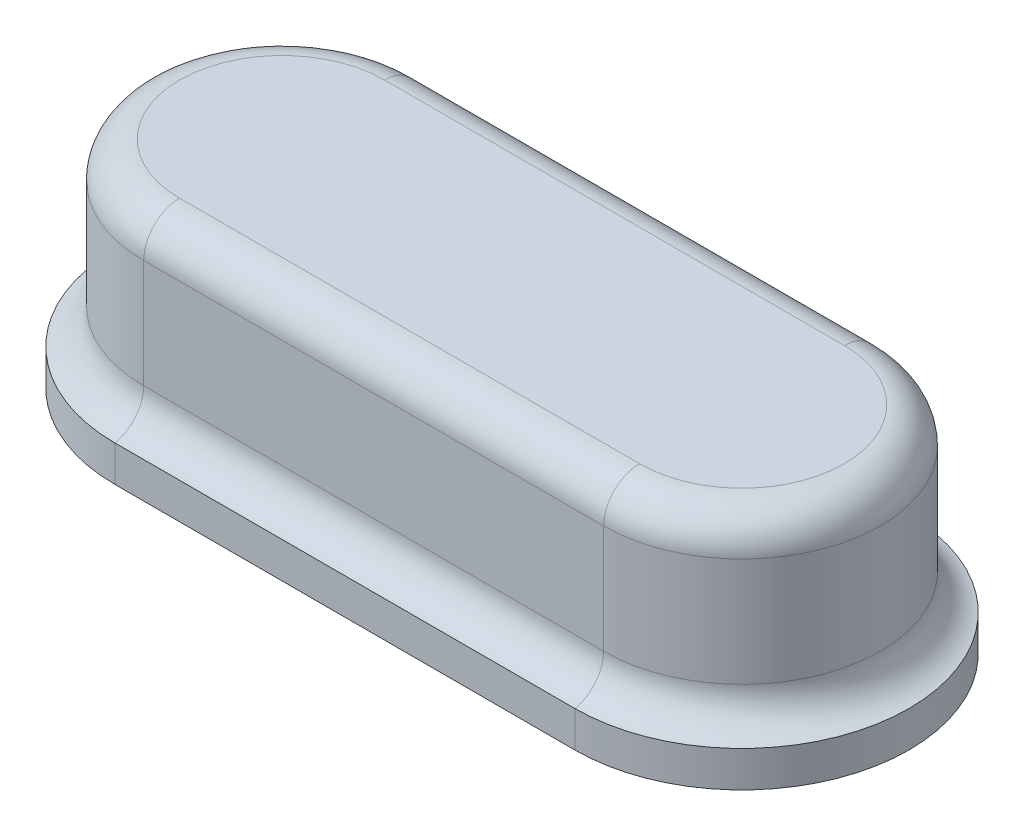
from build123d import *

# Parameters (mm, degrees)
BOSS_EXTRUDE1_DEPTH = 0.5
BOSS_EXTRUDE2_DEPTH = 2.5
FILLET1_R           = 0.5
FILLET3_R           = 0.5


with BuildPart() as part:
    # Sketch1 → Boss-Extrude1 (new body)
    with BuildSketch(Plane(origin=(0, 0, 0), x_dir=(1, 0, 0), z_dir=(0, 1, 0))):
        with BuildLine():
            Line((-3.2, 2.325), (3.2, 2.325))
            ThreePointArc((3.2, 2.325), (5.525, 0), (3.2, -2.325))
            Line((3.2, -2.325), (-3.2, -2.325))
            ThreePointArc((-3.2, -2.325), (-5.525, 0), (-3.2, 2.325))
        make_face()
    extrude(amount=BOSS_EXTRUDE1_DEPTH)

    # Sketch2 → Boss-Extrude2 (add)
    with BuildSketch(Plane(origin=(0, 0.5, 0), x_dir=(1, 0, 0), z_dir=(0, 1, 0))):
        with BuildLine():
            Line((-3.2, -1.925), (3.2, -1.925))
            ThreePointArc((3.2, -1.925), (5.125, 0), (3.2, 1.925))
            Line((3.2, 1.925), (-3.2, 1.925))
            ThreePointArc((-3.2, 1.925), (-5.125, 0), (-3.2, -1.925))
        make_face()
    extrude(amount=BOSS_EXTRUDE2_DEPTH)

    # Fillet1
    # the kernel refuses this fillet: 0.5 mm, written as the material it adds along each edge
    with BuildSketch(Plane(origin=(-3.2, 0.5, 0), x_dir=(0, 0, -1), z_dir=(1, 0, 0))) as fillet1_piece_1:
        with BuildLine():
            CenterArc((2.425, 0.489897949), FILLET1_R, 180, 78.463040967)
            Line((1.925, 0.489897949), (1.915, 0.489897949))
            Line((1.915, 0.489897949), (1.915, 0))
            Line((1.915, 0), (1.925, -0.01))
            ThreePointArc((1.925, -0.01), (2.125, -0.01), (2.323, -0.009797959))
            Line((2.323, -0.009797959), (2.325, 0))
        make_face()
    revolve(axis=Axis((-3.2, 0.5, 0), (0, 1, 0)), revolution_arc=180)
    with BuildSketch(Plane(origin=(-3.2, 0.5, 1.925), x_dir=(0, 1.5665246877455952e-12, 1.0), z_dir=(1, 0, 0)), Plane(origin=(3.2, 0.5, -1.925), x_dir=(0, 1.5665246877455952e-12, -1.0), z_dir=(-1, 0, 0))) as fillet1_piece_2:
        with BuildLine():
            CenterArc((0.5, -0.489897949), FILLET1_R, 101.536959033, 78.463040967)
            Line((0, -0.489897949), (-0.01, -0.489897949))
            Line((-0.01, -0.489897949), (-0.01, 0))
            Line((-0.01, 0), (0, 0.01))
            ThreePointArc((0, 0.01), (0.2, 0.01), (0.398, 0.009797959))
            Line((0.398, 0.009797959), (0.4, 0))
        make_face()
    extrude(amount=6.4)
    with BuildSketch(Plane(origin=(3.2, 0.5, 0), x_dir=(0, 0, 1), z_dir=(-1, 0, 0))) as fillet1_piece_3:
        with BuildLine():
            CenterArc((2.425, 0.489897949), FILLET1_R, 180, 78.463040967)
            Line((1.925, 0.489897949), (1.915, 0.489897949))
            Line((1.915, 0.489897949), (1.915, 0))
            Line((1.915, 0), (1.925, -0.01))
            ThreePointArc((1.925, -0.01), (2.125, -0.01), (2.323, -0.009797959))
            Line((2.323, -0.009797959), (2.325, 0))
        make_face()
    revolve(axis=Axis((3.2, 0.5, 0), (0, 1, 0)), revolution_arc=180)

    # Fillet3
    fillet3_edges = [part.edges().sort_by_distance(p)[0] for p in [
        (-5.125, 3, 0),
        (0, 3, 1.925),
        (5.125, 3, 0),
        (0, 3, -1.925),
    ]]
    fillet(fillet3_edges, radius=FILLET3_R)


solid = part.part
